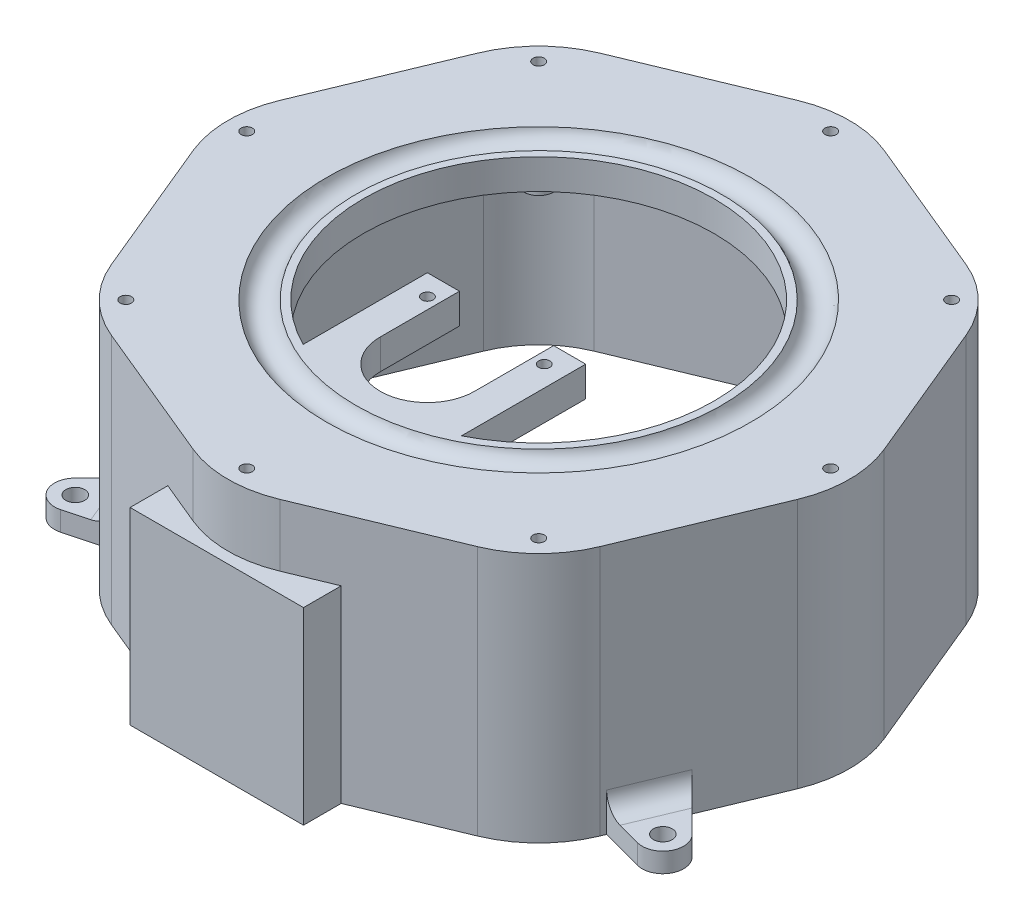
from build123d import *

# Parameters (mm, degrees)
BOSS_EXTRUDE1_DEPTH     = 66.5
BOSS_EXTRUDE2_DEPTH     = 50
SKETCH1_4_R             = 2.5
BOSS_EXTRUDE3_DEPTH     = 5.2
BOSS_EXTRUDE4_START     = -8
BOSS_EXTRUDE4_DEPTH     = 8
FILLET1_R               = 5
SKETCH9_R               = 4
SKETCH5_R               = 46.510119354
CUT_EXTRUDE1_DEPTH      = 144.196072443
BOSS_EXTRUDE5_START     = -8
BOSS_EXTRUDE5_OUTLINE_R = 1.5
BOSS_EXTRUDE5_DEPTH     = 8
BOSS_EXTRUDE6_DEPTH     = 13.5
BOSS_EXTRUDE7_START     = -8
SKETCH7_R               = 4
SKETCH7_R_2             = 1.5
BOSS_EXTRUDE7_DEPTH     = 20
SKETCH7_2_R             = 1.5
CUT_EXTRUDE2_DEPTH      = 144.196072443


# Read off the part's stored shape, not the designer's step: Boss-Extrude5
with BuildPart() as part:
    # Sketch1 → Boss-Extrude1 (new body)
    with BuildSketch(Plane(origin=(0, 0, 0), x_dir=(1, 0, 0), z_dir=(0, 1, 0))):
        with BuildLine():
            Line((-48.571666642, -64.807549647), (-11.480502971, -80.171212684))
            ThreePointArc((-11.480502971, -80.171212684), (0, -82.454826708), (11.480502971, -80.171212684))
            Line((11.480502971, -80.171212684), (48.571666642, -64.807549647))
            ThreePointArc((48.571666642, -64.807549647), (58.304367107, -58.304367107), (64.807549647, -48.571666642))
            Line((64.807549647, -48.571666642), (80.171212684, -11.480502971))
            ThreePointArc((80.171212684, -11.480502971), (82.454826708, 0), (80.171212684, 11.480502971))
            Line((80.171212684, 11.480502971), (64.807549647, 48.571666642))
            ThreePointArc((64.807549647, 48.571666642), (58.304367107, 58.304367107), (48.571666642, 64.807549647))
            Line((48.571666642, 64.807549647), (11.480502971, 80.171212684))
            ThreePointArc((11.480502971, 80.171212684), (0, 82.454826708), (-11.480502971, 80.171212684))
            Line((-11.480502971, 80.171212684), (-48.571666642, 64.807549647))
            ThreePointArc((-48.571666642, 64.807549647), (-58.304367107, 58.304367107), (-64.807549647, 48.571666642))
            Line((-64.807549647, 48.571666642), (-80.171212684, 11.480502971))
            ThreePointArc((-80.171212684, 11.480502971), (-82.454826708, 0), (-80.171212684, -11.480502971))
            Line((-80.171212684, -11.480502971), (-64.807549647, -48.571666642))
            ThreePointArc((-64.807549647, -48.571666642), (-58.304367107, -58.304367107), (-48.571666642, -64.807549647))
        make_face()
        with BuildLine():
            ThreePointArc((-62.035911049, -47.423616345), (-56.183046763, -56.183046763), (-47.423616345, -62.035911049))
            Line((-47.423616345, -62.035911049), (-10.332452674, -77.399574086))
            ThreePointArc((-10.332452674, -77.399574086), (0, -79.454826708), (10.332452674, -77.399574086))
            Line((10.332452674, -77.399574086), (47.423616345, -62.035911049))
            ThreePointArc((47.423616345, -62.035911049), (56.183046763, -56.183046763), (62.035911049, -47.423616345))
            Line((62.035911049, -47.423616345), (77.399574086, -10.332452674))
            ThreePointArc((77.399574086, -10.332452674), (79.454826708, 0), (77.399574086, 10.332452674))
            Line((77.399574086, 10.332452674), (62.035911049, 47.423616345))
            ThreePointArc((62.035911049, 47.423616345), (56.183046763, 56.183046763), (47.423616345, 62.035911049))
            Line((47.423616345, 62.035911049), (10.332452674, 77.399574086))
            ThreePointArc((10.332452674, 77.399574086), (0, 79.454826708), (-10.332452674, 77.399574086))
            Line((-10.332452674, 77.399574086), (-47.423616345, 62.035911049))
            ThreePointArc((-47.423616345, 62.035911049), (-56.183046763, 56.183046763), (-62.035911049, 47.423616345))
            Line((-62.035911049, 47.423616345), (-77.399574086, 10.332452674))
            ThreePointArc((-77.399574086, 10.332452674), (-79.454826708, 0), (-77.399574086, -10.332452674))
            Line((-77.399574086, -10.332452674), (-62.035911049, -47.423616345))
        make_face(mode=Mode.SUBTRACT)
    extrude(amount=BOSS_EXTRUDE1_DEPTH)

    # Sketch1<3> → Boss-Extrude2 (add)
    with BuildSketch(Plane(origin=(0, 0, 0), x_dir=(1, 0, 0), z_dir=(0, 1, 0))):
        with BuildLine():
            Line((23, -85.399680782), (23, -75.399680782))
            Line((23, -75.399680782), (11.480502971, -80.171212684))
            ThreePointArc((11.480502971, -80.171212684), (0, -82.454826708), (-11.480502971, -80.171212684))
            Line((-11.480502971, -80.171212684), (-23, -75.399680782))
            Line((-23, -75.399680782), (-23, -85.399680782))
            Line((-23, -85.399680782), (23, -85.399680782))
        make_face()
    extrude(amount=BOSS_EXTRUDE2_DEPTH)

    # Sketch1<4> → Boss-Extrude3 (add)
    # profile 1 of 3: a face of its own
    with BuildSketch(Plane(origin=(0, 0, 0), x_dir=(1, 0, 0), z_dir=(0, 1, 0))):
        with BuildLine():
            Line((-65.328431438, -47.314146758), (-71.978916488, -31.258455554))
            Line((-71.978916488, -31.258455554), (-81.831373637, -41.110912703))
            ThreePointArc((-81.831373637, -41.110912703), (-82.705426061, -47.75), (-76.518781593, -50.312592045))
            Line((-76.518781593, -50.312592045), (-65.328431438, -47.314146758))
        make_face()
        with Locations(Location((-77.942286341, -45, 0), (0, 0, 270))):
            Circle(SKETCH1_4_R, mode=Mode.SUBTRACT)
    # profile 2 of 3: a face of its own
    with BuildSketch(Plane(origin=(0, 0, 0), x_dir=(1, 0, 0), z_dir=(0, 1, 0))):
        with BuildLine():
            Line((81.831373637, -41.110912703), (71.978916488, -31.258455554))
            Line((71.978916488, -31.258455554), (65.328431438, -47.314146758))
            Line((65.328431438, -47.314146758), (76.518781593, -50.312592045))
            ThreePointArc((76.518781593, -50.312592045), (82.705426061, -47.75), (81.831373637, -41.110912703))
        make_face()
        with Locations(Location((77.942286341, -45, 0), (0, 0, 270))):
            Circle(SKETCH1_4_R, mode=Mode.SUBTRACT)
    # profile 3 of 3: a face of its own
    with BuildSketch(Plane(origin=(0, 0, 0), x_dir=(1, 0, 0), z_dir=(0, 1, 0))):
        with BuildLine():
            ThreePointArc((-8.00737156, 81.36645068), (0, 82.454826708), (8.00737156, 81.36645068))
            Line((8.00737156, 81.36645068), (5.312592045, 91.423504748))
            ThreePointArc((5.312592045, 91.423504748), (0, 95.5), (-5.312592045, 91.423504748))
            Line((-5.312592045, 91.423504748), (-8.00737156, 81.36645068))
        make_face()
        with Locations(Location((0, 90, 0), (0, 0, 270))):
            Circle(SKETCH1_4_R, mode=Mode.SUBTRACT)
    extrude(amount=BOSS_EXTRUDE3_DEPTH)

    # Sketch2 → Boss-Extrude4 (add)
    with BuildSketch(Plane(origin=(0, 66.5, 0), x_dir=(1, 0, 0), z_dir=(0, 1, 0)).offset(BOSS_EXTRUDE4_START)):
        with BuildLine():
            Line((-80.171212684, -11.480502971), (-64.807549647, -48.571666642))
            ThreePointArc((-64.807549647, -48.571666642), (-58.304367107, -58.304367107), (-48.571666642, -64.807549647))
            Line((-48.571666642, -64.807549647), (-11.480502971, -80.171212684))
            ThreePointArc((-11.480502971, -80.171212684), (0, -82.454826708), (11.480502971, -80.171212684))
            Line((11.480502971, -80.171212684), (48.571666642, -64.807549647))
            ThreePointArc((48.571666642, -64.807549647), (58.304367107, -58.304367107), (64.807549647, -48.571666642))
            Line((64.807549647, -48.571666642), (80.171212684, -11.480502971))
            ThreePointArc((80.171212684, -11.480502971), (82.454826708, 0), (80.171212684, 11.480502971))
            Line((80.171212684, 11.480502971), (64.807549647, 48.571666642))
            ThreePointArc((64.807549647, 48.571666642), (58.304367107, 58.304367107), (48.571666642, 64.807549647))
            Line((48.571666642, 64.807549647), (11.480502971, 80.171212684))
            ThreePointArc((11.480502971, 80.171212684), (0, 82.454826708), (-11.480502971, 80.171212684))
            Line((-11.480502971, 80.171212684), (-48.571666642, 64.807549647))
            ThreePointArc((-48.571666642, 64.807549647), (-58.304367107, 58.304367107), (-64.807549647, 48.571666642))
            Line((-64.807549647, 48.571666642), (-80.171212684, 11.480502971))
            ThreePointArc((-80.171212684, 11.480502971), (-82.454826708, 0), (-80.171212684, -11.480502971))
        make_face()
    extrude(amount=BOSS_EXTRUDE4_DEPTH)

    # Fillet1
    fillet1_edges = [part.edges().sort_by_distance(p)[0] for p in [
        (-68.653673963, 5.2, 39.286301156),
        (68.653673963, 5.2, 39.286301156),
        (0, 5.2, -82.454826708),
    ]]
    fillet(fillet1_edges, radius=FILLET1_R)

    # Cut-Sweep2: sweep along a path in Sketch3
    with BuildLine(Plane(origin=(0, 66.5, 0), x_dir=(1, 0, 0), z_dir=(0, 1, 0))) as cut_sweep2_path:
        CenterArc((0, 0), 52.3831027, 0, 360)
    # Sketch9 → Cut-Sweep2 (sweep, cut)
    with BuildSketch(Plane(origin=(0, 0, 0), x_dir=(0, 0, -1), z_dir=(1, 0, 0))):
        with Locations((-52.3831027, 67.5)):
            Circle(SKETCH9_R)
    sweep(path=cut_sweep2_path.line, mode=Mode.SUBTRACT)

    # Sketch5 → Cut-Extrude1 (cut, through all)
    with BuildSketch(Plane(origin=(0, 66.5, 0), x_dir=(1, 0, 0), z_dir=(0, 1, 0))):
        with Locations(Location((0, 0, 0), (0, 0, 270))):
            Circle(SKETCH5_R)
    extrude(amount=-CUT_EXTRUDE1_DEPTH, mode=Mode.SUBTRACT)

    # Boss-Extrude5 outline → Boss-Extrude5 (add)
    with BuildSketch(Plane.XZ.offset(-58.5).offset(BOSS_EXTRUDE5_START)):
        with BuildLine():
            ThreePointArc((-12.5, 29.529273706), (0, 42.029273706), (12.5, 29.529273706))
            Line((12.5, 29.529273706), (12.5, 8.529273706))
            Line((12.5, 8.529273706), (21, 8.529273706))
            Line((21, 8.529273706), (21, 41.499291588))
            ThreePointArc((21, 41.499291588), (0, 46.510119354), (-21, 41.499291588))
            Line((-21, 41.499291588), (-21, 8.529273706))
            Line((-21, 8.529273706), (-12.5, 8.529273706))
            Line((-12.5, 8.529273706), (-12.5, 29.529273706))
        make_face()
        with Locations((-15.5, 14.029273706)):
            Circle(BOSS_EXTRUDE5_OUTLINE_R, mode=Mode.SUBTRACT)
        with Locations((15.5, 14.029273706)):
            Circle(BOSS_EXTRUDE5_OUTLINE_R, mode=Mode.SUBTRACT)
    extrude(amount=BOSS_EXTRUDE5_DEPTH)

    # Sketch6 → Boss-Extrude6 (add)
    with BuildSketch(Plane.XZ.offset(-58.5)):
        with BuildLine():
            Line((21, 50.529273706), (21, 41.499291588))
            Line((21, 41.499291588), (32.130440464, 68.370551911))
            Line((32.130440464, 68.370551911), (11.480502971, 76.924036083))
            ThreePointArc((11.480502971, 76.924036083), (0, 79.207650107), (-11.480502971, 76.924036083))
            Line((-11.480502971, 76.924036083), (-32.130440464, 68.370551911))
            Line((-32.130440464, 68.370551911), (-21, 41.499291588))
            Line((-21, 41.499291588), (-21, 50.529273706))
            Line((-21, 50.529273706), (21, 50.529273706))
        make_face()
    extrude(amount=BOSS_EXTRUDE6_DEPTH)

    # Sketch7 → Boss-Extrude7 (add)
    # profile 1 of 8: a face of its own
    with BuildSketch(Plane(origin=(0, 66.5, 0), x_dir=(1, 0, 0), z_dir=(0, 1, 0)).offset(BOSS_EXTRUDE7_START)):
        with Locations((-54.768833201, 54.768833201)):
            Circle(SKETCH7_R)
        with Locations(Location((-54.768833201, 54.768833201, 0), (0, 0, 270))):
            Circle(SKETCH7_R_2, mode=Mode.SUBTRACT)
    # profile 2 of 8: a face of its own
    with BuildSketch(Plane(origin=(0, 66.5, 0), x_dir=(1, 0, 0), z_dir=(0, 1, 0)).offset(BOSS_EXTRUDE7_START)):
        with Locations((0, 77.454826708)):
            Circle(SKETCH7_R)
        with Locations(Location((0, 77.454826708, 0), (0, 0, 270))):
            Circle(SKETCH7_R_2, mode=Mode.SUBTRACT)
    # profile 3 of 8: a face of its own
    with BuildSketch(Plane(origin=(0, 66.5, 0), x_dir=(1, 0, 0), z_dir=(0, 1, 0)).offset(BOSS_EXTRUDE7_START)):
        with Locations((54.768833201, 54.768833201)):
            Circle(SKETCH7_R)
        with Locations(Location((54.768833201, 54.768833201, 0), (0, 0, 270))):
            Circle(SKETCH7_R_2, mode=Mode.SUBTRACT)
    # profile 4 of 8: a face of its own
    with BuildSketch(Plane(origin=(0, 66.5, 0), x_dir=(1, 0, 0), z_dir=(0, 1, 0)).offset(BOSS_EXTRUDE7_START)):
        with Locations((77.454826708, 0)):
            Circle(SKETCH7_R)
        with Locations(Location((77.454826708, 0, 0), (0, 0, 270))):
            Circle(SKETCH7_R_2, mode=Mode.SUBTRACT)
    # profile 5 of 8: a face of its own
    with BuildSketch(Plane(origin=(0, 66.5, 0), x_dir=(1, 0, 0), z_dir=(0, 1, 0)).offset(BOSS_EXTRUDE7_START)):
        with Locations((54.768833201, -54.768833201)):
            Circle(SKETCH7_R)
        with Locations(Location((54.768833201, -54.768833201, 0), (0, 0, 270))):
            Circle(SKETCH7_R_2, mode=Mode.SUBTRACT)
    # profile 6 of 8: a face of its own
    with BuildSketch(Plane(origin=(0, 66.5, 0), x_dir=(1, 0, 0), z_dir=(0, 1, 0)).offset(BOSS_EXTRUDE7_START)):
        with Locations((0, -77.454826708)):
            Circle(SKETCH7_R)
        with Locations(Location((0, -77.454826708, 0), (0, 0, 270))):
            Circle(SKETCH7_R_2, mode=Mode.SUBTRACT)
    # profile 7 of 8: a face of its own
    with BuildSketch(Plane(origin=(0, 66.5, 0), x_dir=(1, 0, 0), z_dir=(0, 1, 0)).offset(BOSS_EXTRUDE7_START)):
        with Locations((-54.768833201, -54.768833201)):
            Circle(SKETCH7_R)
        with Locations(Location((-54.768833201, -54.768833201, 0), (0, 0, 270))):
            Circle(SKETCH7_R_2, mode=Mode.SUBTRACT)
    # profile 8 of 8: a face of its own
    with BuildSketch(Plane(origin=(0, 66.5, 0), x_dir=(1, 0, 0), z_dir=(0, 1, 0)).offset(BOSS_EXTRUDE7_START)):
        with Locations((-77.454826708, 0)):
            Circle(SKETCH7_R)
        with Locations(Location((-77.454826708, 0, 0), (0, 0, 270))):
            Circle(SKETCH7_R_2, mode=Mode.SUBTRACT)
    extrude(amount=-BOSS_EXTRUDE7_DEPTH)

    # Sketch7<2> → Cut-Extrude2 (cut, through all)
    with BuildSketch(Plane(origin=(0, 66.5, 0), x_dir=(1, 0, 0), z_dir=(0, 1, 0))):
        with Locations(Location((-54.768833201, -54.768833201, 0), (0, 0, 270))):
            Circle(SKETCH7_2_R)
        with Locations(Location((-77.454826708, 0, 0), (0, 0, 270))):
            Circle(SKETCH7_2_R)
        with Locations(Location((-54.768833201, 54.768833201, 0), (0, 0, 270))):
            Circle(SKETCH7_2_R)
        with Locations(Location((0, 77.454826708, 0), (0, 0, 270))):
            Circle(SKETCH7_2_R)
        with Locations(Location((54.768833201, 54.768833201, 0), (0, 0, 270))):
            Circle(SKETCH7_2_R)
        with Locations(Location((77.454826708, 0, 0), (0, 0, 270))):
            Circle(SKETCH7_2_R)
        with Locations(Location((54.768833201, -54.768833201, 0), (0, 0, 270))):
            Circle(SKETCH7_2_R)
        with Locations(Location((0, -77.454826708, 0), (0, 0, 270))):
            Circle(SKETCH7_2_R)
    extrude(amount=-CUT_EXTRUDE2_DEPTH, mode=Mode.SUBTRACT)


solid = part.part
